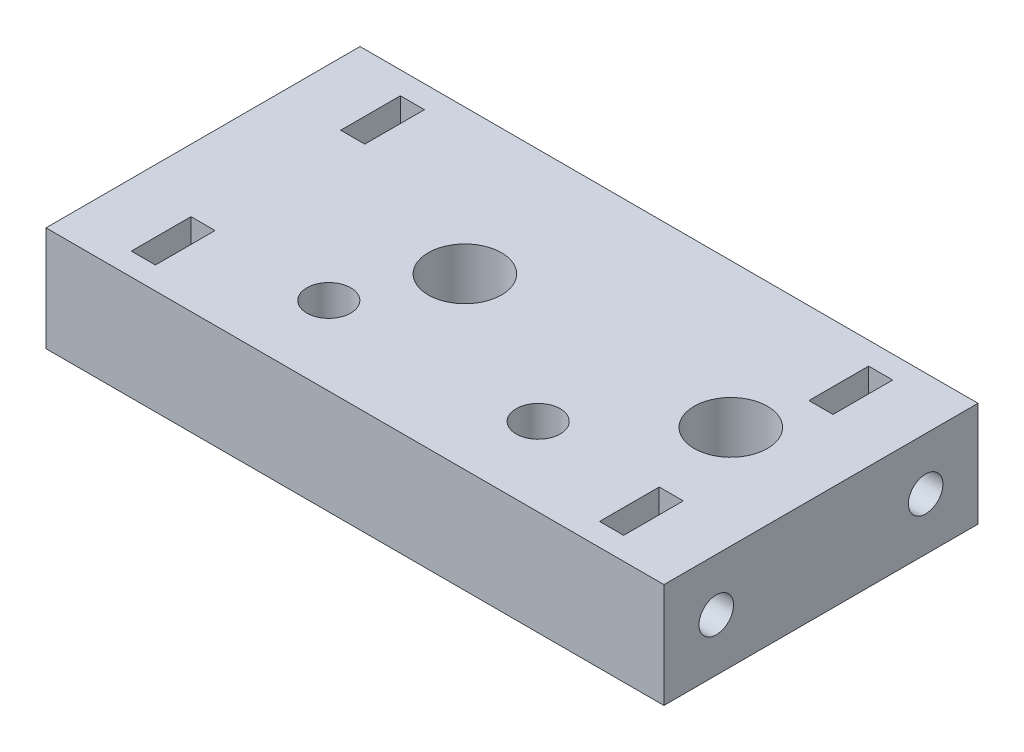
from build123d import *

# Parameters (mm, degrees)
SKETCH1_W           = 59.0272
SKETCH1_H           = 30
BOSS_EXTRUDE1_DEPTH = 10
SKETCH2_R           = 2.1
CUT_EXTRUDE1_DEPTH  = 35.58399319
SKETCH3_R           = 1.65
CUT_EXTRUDE2_DEPTH  = 12
CUT_EXTRUDE3_START  = -12
SKETCH4_R           = 1.65
CUT_EXTRUDE3_DEPTH  = 12
CUT_EXTRUDE4_DEPTH  = 2.3
CUT_EXTRUDE5_DEPTH  = 2.3
SKETCH7_R           = 3.5
CUT_EXTRUDE6_DEPTH  = 35.58399319


with BuildPart() as part:
    # Sketch1 → Boss-Extrude1 (new body)
    with BuildSketch(Plane(origin=(0, 0, 0), x_dir=(1, 0, 0), z_dir=(0, 1, 0))):
        Rectangle(SKETCH1_W, SKETCH1_H)
    extrude(amount=BOSS_EXTRUDE1_DEPTH)

    # Sketch2 → Cut-Extrude1 (cut, through all)
    with BuildSketch(Plane(origin=(0, 10, 0), x_dir=(1, 0, 0), z_dir=(0, 1, 0))):
        with Locations((-10, -7.5)):
            Circle(SKETCH2_R)
        with Locations((10, -7.5)):
            Circle(SKETCH2_R)
    extrude(amount=-CUT_EXTRUDE1_DEPTH, mode=Mode.SUBTRACT)

    # Sketch3 → Cut-Extrude2 (cut)
    with BuildSketch(Plane(origin=(29.5136, 0, 0), x_dir=(0, 0, -1), z_dir=(1, 0, 0))):
        with Locations((-10, 5)):
            Circle(SKETCH3_R)
        with Locations((10, 5)):
            Circle(SKETCH3_R)
    extrude(amount=-CUT_EXTRUDE2_DEPTH, mode=Mode.SUBTRACT)

    # Sketch4 → Cut-Extrude3 (cut)
    with BuildSketch(Plane.ZY.offset(29.5136).offset(CUT_EXTRUDE3_START)):
        with Locations((-10, 5)):
            Circle(SKETCH4_R)
        with Locations((10, 5)):
            Circle(SKETCH4_R)
    extrude(amount=CUT_EXTRUDE3_DEPTH, mode=Mode.SUBTRACT)

    # Sketch5 → Cut-Extrude4 (cut)
    with BuildSketch(Plane(origin=(23.5136, 0, 0), x_dir=(0, 0, -1), z_dir=(1, 0, 0))):
        Polygon((-12.85, 6.645448267), (-12.85, 10), (-7.15, 10), (-7.15, 6.645448267), (-7.15, 3.354551733), (-10, 1.709103466), (-12.85, 3.354551733), align=None)
        Polygon((7.15, 6.645448267), (7.15, 3.354551733), (10, 1.709103466), (12.85, 3.354551733), (12.85, 6.645448267), (12.85, 10), (7.15, 10), align=None)
    extrude(amount=-CUT_EXTRUDE4_DEPTH, mode=Mode.SUBTRACT)

    # Sketch6 → Cut-Extrude5 (cut)
    with BuildSketch(Plane.ZY.offset(23.5136)):
        Polygon((-12.85, 6.645448267), (-12.85, 10), (-7.15, 10), (-7.15, 6.645448267), (-7.15, 3.354551733), (-10, 1.709103466), (-12.85, 3.354551733), align=None)
        Polygon((7.15, 6.645448267), (7.15, 3.354551733), (10, 1.709103466), (12.85, 3.354551733), (12.85, 6.645448267), (12.85, 10), (7.15, 10), align=None)
    extrude(amount=-CUT_EXTRUDE5_DEPTH, mode=Mode.SUBTRACT)

    # Sketch7 → Cut-Extrude6 (cut, through all)
    with BuildSketch(Plane(origin=(0, 10, 0), x_dir=(1, 0, 0), z_dir=(0, 1, 0))):
        with Locations((19.7, 1.2)):
            Circle(SKETCH7_R)
        with Locations((-5.7, 1.2)):
            Circle(SKETCH7_R)
    extrude(amount=-CUT_EXTRUDE6_DEPTH, mode=Mode.SUBTRACT)


solid = part.part
